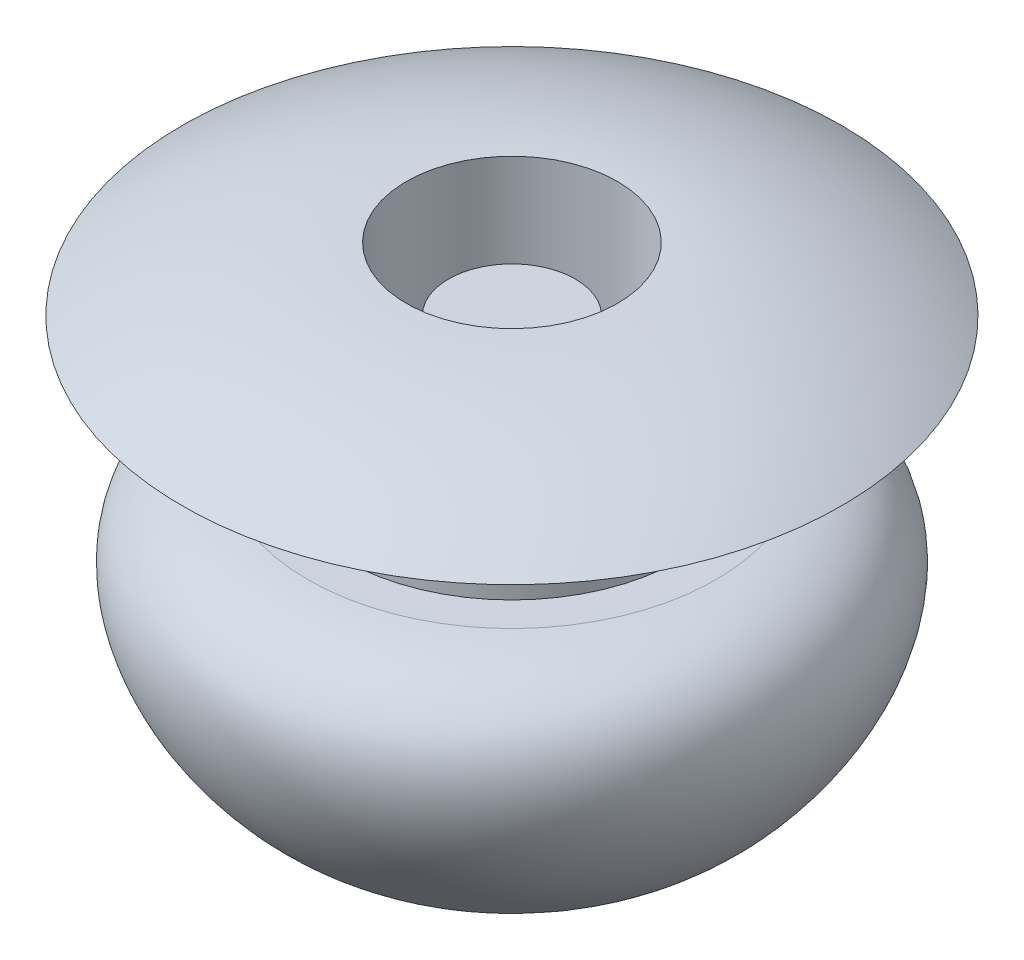
from build123d import *


with BuildPart() as part:
    # Szkic1 → Obrót1 (revolve)
    with BuildSketch(Plane(origin=(0, 0, 0), x_dir=(0, 0, -1), z_dir=(1, 0, 0))):
        with BuildLine():
            Line((0, 0), (-0.75, 0))
            Line((-0.75, 0), (-0.75, -1.700748907))
            Line((-0.75, -1.700748907), (-1.25, -1.700748907))
            Line((-1.25, -1.700748907), (-1.25, 0.75))
            ThreePointArc((-1.25, 0.75), (-2.627043935, 0.558888572), (-3.9, 0))
            Line((-3.9, 0), (-2, 0))
            Line((-2, 0), (-2, -1.500010384))
            Line((-2, -1.500010384), (-2.413891755, -1.500010384))
            add(Edge.make_bspline(
                [(-2.413891755, -1.500010384), (-3.867503112, -1.669667706), (-3.528877649, -3.80202401), (-1.083961642, -5.373542753), (-0.271752618, -3.374959681), (-0.956030427, -3.078939577)],
                knots=[0, 0, 0, 0, 0.464993082, 0.721927553, 1, 1, 1, 1], degree=3))
            add(Edge.make_bspline(
                [(-0.956030427, -3.078939577), (-0.520263876, -3.200748907), (0, -3.200748907)],
                knots=[0.992852221, 0.992852221, 0.992852221, 1.570796327, 1.570796327, 1.570796327], degree=2, weights=[1, 0.958537313, 1]))
            Line((0, -3.200748907), (0, -1.700748907))
            Line((0, -1.700748907), (0, 0))
        make_face()
    revolve(axis=Axis((0, 0, 0), (0, 1, 0)))


solid = part.part
